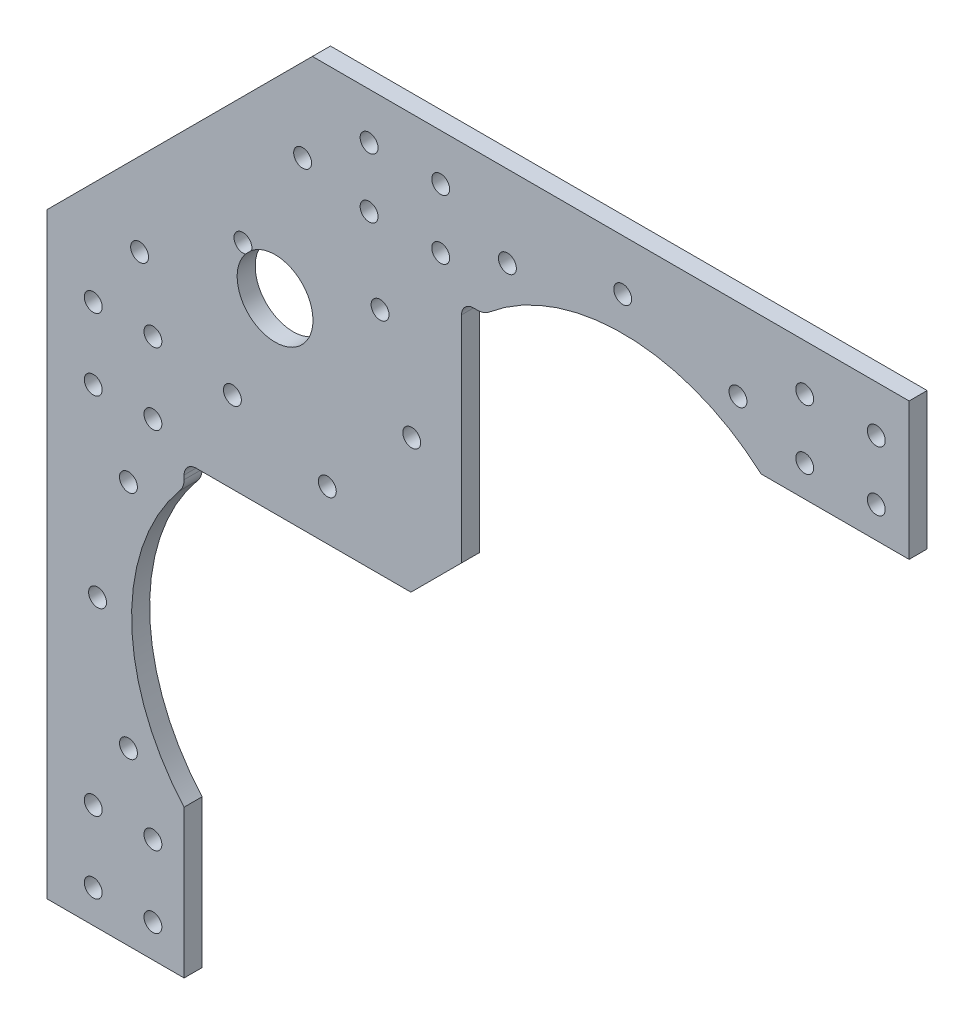
from build123d import *

# Parameters (mm, degrees)
BOSS_EXTRUDE1_DEPTH     = 3.0226
SKETCH3_R               = 1.5
CUT_EXTRUDE1_DEPTH      = 10
SKETCH4_R               = 1.5
CUT_EXTRUDE2_DEPTH      = 137.505077234
CUT_EXTRUDE3_DEPTH      = 137.505077234
CUT_EXTRUDE3_DEPTH_BACK = 137.505077234
SKETCH5_R               = 6.35


with BuildPart() as part:
    # Sketch1 → Boss-Extrude1 (new body)
    with BuildSketch(Plane.XY):
        with BuildLine():
            Line((-96.5, -48), (-73.5, -48))
            Line((-73.5, -48), (-73.5, -23.206895527))
            ThreePointArc((-73.5, -23.206895527), (-82.295939504, -0.533121187), (-74.194736842, 22.398060858))
            ThreePointArc((-74.194736842, 22.398060858), (-73.679025924, 23.297059075), (-73.5, 24.317894646))
            Line((-73.5, 24.317894646), (-73.5, 25))
            ThreePointArc((-73.5, 25), (-72.914213562, 26.414213562), (-71.5, 27))
            Line((-71.5, 27), (-35.485281374, 27))
            Line((-35.485281374, 27), (-27, 35.485281374))
            Line((-27, 35.485281374), (-27, 71.5))
            ThreePointArc((-27, 71.5), (-26.414213562, 72.914213562), (-25, 73.5))
            Line((-25, 73.5), (-24.317894646, 73.5))
            ThreePointArc((-24.317894646, 73.5), (-23.297059075, 73.679025924), (-22.398060858, 74.194736842))
            ThreePointArc((-22.398060858, 74.194736842), (0.533121187, 82.295939504), (23.206895527, 73.5))
            Line((23.206895527, 73.5), (48, 73.5))
            Line((48, 73.5), (48, 96.5))
            Line((48, 96.5), (-52, 96.5))
            Line((-52, 96.5), (-96.5, 52))
            Line((-96.5, 52), (-96.5, -48))
        make_face()
    extrude(amount=BOSS_EXTRUDE1_DEPTH)

    # Sketch3 → Cut-Extrude1 (cut)
    with BuildSketch(Plane.XY.offset(3.0226)):
        with Locations((30.5, 78.72592343)):
            Circle(SKETCH3_R)
        with Locations((30.5, 88.72592343)):
            Circle(SKETCH3_R)
        with Locations((42.5, 88.72592343)):
            Circle(SKETCH3_R)
        with Locations((42.5, 78.72592343)):
            Circle(SKETCH3_R)
        with Locations((-42.5, 78.72592343)):
            Circle(SKETCH3_R)
        with Locations((-42.5, 88.72592343)):
            Circle(SKETCH3_R)
        with Locations((-30.5, 88.72592343)):
            Circle(SKETCH3_R)
        with Locations((-30.5, 78.72592343)):
            Circle(SKETCH3_R)
        with Locations((-88.72592343, 30.5)):
            Circle(SKETCH3_R)
        with Locations((-88.72592343, 42.5)):
            Circle(SKETCH3_R)
        with Locations((-78.72592343, 42.5)):
            Circle(SKETCH3_R)
        with Locations((-78.72592343, 30.5)):
            Circle(SKETCH3_R)
        with Locations((-88.72592343, -42.5)):
            Circle(SKETCH3_R)
        with Locations((-88.72592343, -30.5)):
            Circle(SKETCH3_R)
        with Locations((-78.72592343, -30.5)):
            Circle(SKETCH3_R)
        with Locations((-78.72592343, -42.5)):
            Circle(SKETCH3_R)
    extrude(amount=-CUT_EXTRUDE1_DEPTH, mode=Mode.SUBTRACT)

    # Sketch4 → Cut-Extrude2 (cut, through all)
    with BuildSketch(Plane.XY.offset(3.0226)):
        with Locations((-88, 0)):
            Circle(SKETCH4_R)
        with Locations((-63.639610307, 63.639610307)):
            Circle(SKETCH4_R)
        with Locations((0, 88)):
            Circle(SKETCH4_R)
        with Locations((-80.960118382, 53.639610307)):
            Circle(SKETCH4_R)
        with Locations((-53.639610307, 80.960118382)):
            Circle(SKETCH4_R)
        with Locations((19.318516526, 82.823619098)):
            Circle(SKETCH4_R)
        with Locations((-19.318516526, 82.823619098)):
            Circle(SKETCH4_R)
        with Locations((-82.823619098, 19.318516526)):
            Circle(SKETCH4_R)
        with Locations((-82.823619098, -19.318516526)):
            Circle(SKETCH4_R)
        with Locations((-40.658639918, 65.40737726)):
            Circle(SKETCH4_R)
        with Locations((-65.40737726, 40.658639918)):
            Circle(SKETCH4_R)
        with Locations((-49.497474683, 35.355339059)):
            Circle(SKETCH4_R)
        with Locations((-35.355339059, 49.497474683)):
            Circle(SKETCH4_R)
    extrude(amount=-CUT_EXTRUDE2_DEPTH, mode=Mode.SUBTRACT)

    # Sketch5 → Cut-Extrude3 (cut, two sides: drawn at the far end of the back side and taken through both)
    with BuildSketch(Plane.XY.offset(3.0226).offset(-CUT_EXTRUDE3_DEPTH_BACK)):
        with Locations((-58.256782336, 58.256501806)):
            Circle(SKETCH5_R)
    extrude(amount=CUT_EXTRUDE3_DEPTH + CUT_EXTRUDE3_DEPTH_BACK, mode=Mode.SUBTRACT)


solid = part.part
